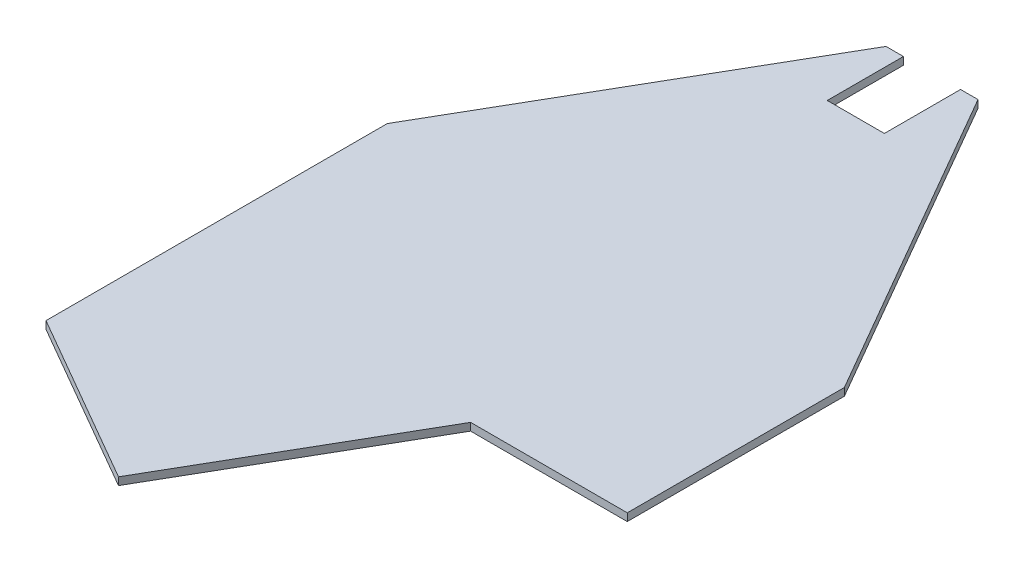
from build123d import *

# Parameters (mm, degrees)
BOSS_EXTRUDE2_DEPTH = 20


with BuildPart() as part:
    # Sketch1 → Boss-Extrude2 (new body)
    with BuildSketch(Plane(origin=(0, 0, 0), x_dir=(1, 0, 0), z_dir=(0, 1, 0))):
        Polygon((600, 0), (188.675134595, 0), (-149.675037911, -586.03968953), (-600, -326.044451446), (-600, 0), (-600, 570), (-120.799276573, 1400), (-75, 1400), (-75, 1200), (75, 1200), (75, 1400), (120.799276573, 1400), (600, 570), align=None)
    extrude(amount=BOSS_EXTRUDE2_DEPTH)


solid = part.part
